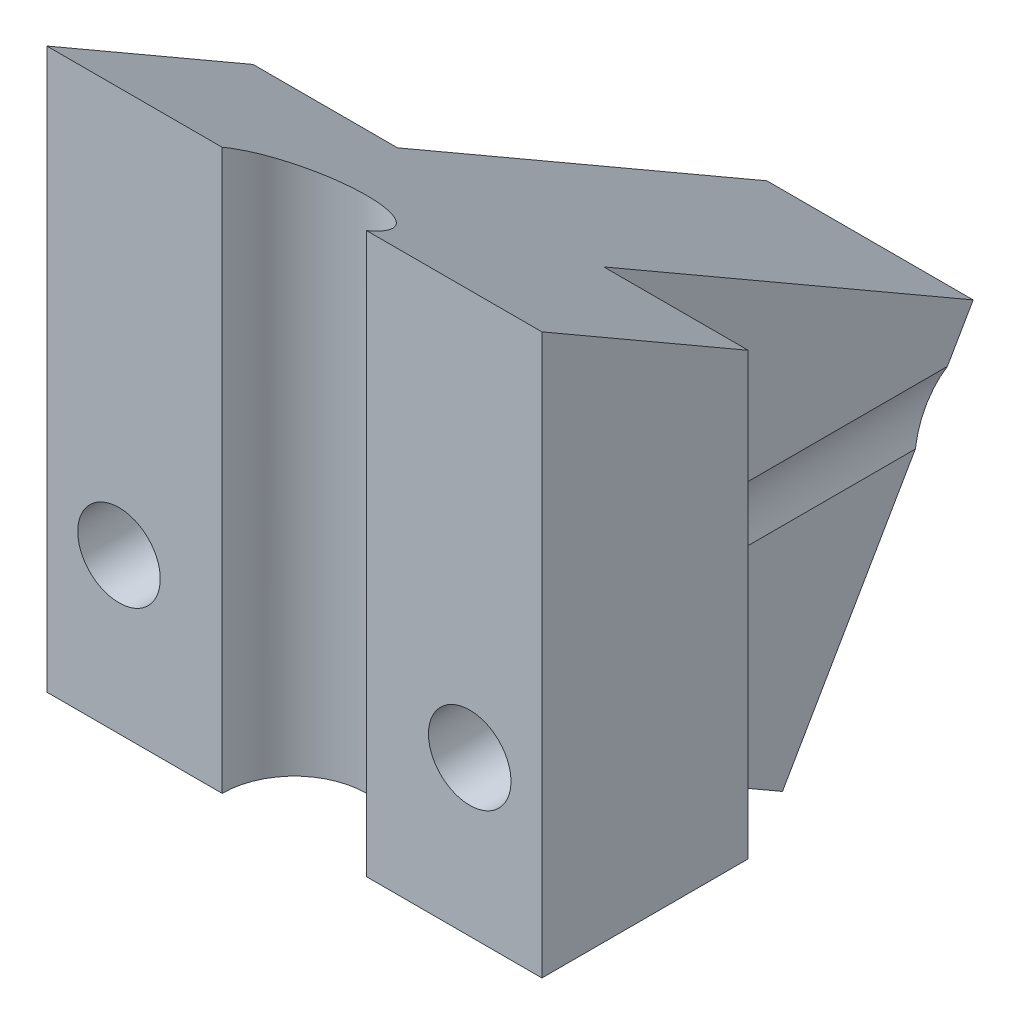
from build123d import *

# Parameters (mm, degrees)
SKETCH_1_W              = 48
SKETCH_1_H              = 20
EXTRUDE_1_DEPTH         = 30
SKETCH_2_W              = 14
SKETCH_2_H              = 30
CUT_EXTRUDE_1_DEPTH     = 7
EXTRUDE_2_DEPTH         = 48
CUT_EXTRUDE_2_DEPTH     = 14
CUT_EXTRUDE_3_DEPTH     = 14
CUT_EXTRUDE_4_DEPTH     = 65.456478054
SKETCH_13_R             = 4
CUT_EXTRUDE_5_DEPTH     = 53.52066051
SKETCH_14_R             = 4
CUT_EXTRUDE_6_DEPTH     = 53.52066051
FILLET_1_R              = 7
EXTRUDE_3_DEPTH         = 3
EXTRUDE_5_DEPTH         = 1
SKETCH_20_R             = 7.5
CUT_EXTRUDE_8_DEPTH     = 53.520660579
BOSS_EXTRUDE1_DEPTH     = 25
CUT_EXTRUDE1_DEPTH      = 80.244164279
CUT_EXTRUDE1_DEPTH_BACK = 80.244164279


with BuildPart() as part:
    # Эскиз1 → Бобышка-Вытянуть1 (new body)
    with BuildSketch(Plane(origin=(0, 0, 0), x_dir=(1, 0, 0), z_dir=(0, 1, 0))):
        Rectangle(SKETCH_1_W, SKETCH_1_H)
    extrude(amount=EXTRUDE_1_DEPTH)

    # Эскиз2 → Вырез-Вытянуть1 (cut)
    with BuildSketch(Plane.XY.offset(10)):
        with Locations((0, 15)):
            Rectangle(SKETCH_2_W, SKETCH_2_H)
    extrude(amount=-CUT_EXTRUDE_1_DEPTH, mode=Mode.SUBTRACT)

    # Эскиз7 → Бобышка-Вытянуть2 (add)
    with BuildSketch(Plane(origin=(24, 0, 0), x_dir=(0, 0, -1), z_dir=(1, 0, 0))):
        Polygon((10, 0), (27.320508076, -10), (45.810889132, 22.026279442), (32, 30), (10, 30), align=None)
    extrude(amount=-EXTRUDE_2_DEPTH)

    # Эскиз8 → Вырез-Вытянуть2 (cut)
    with BuildSketch(Plane(origin=(24, 0, 0), x_dir=(0, 0, -1), z_dir=(1, 0, 0))):
        Polygon((10, 0), (10, 30), (32, 30), (45.810889132, 22.026279442), (27.320508076, -10), align=None)
    extrude(amount=-CUT_EXTRUDE_2_DEPTH, mode=Mode.SUBTRACT)

    # Эскиз9 → Вырез-Вытянуть3 (cut)
    with BuildSketch(Plane.ZY.offset(24)):
        Polygon((-10, 0), (-10, 30), (-32, 30), (-45.810889132, 22.026279442), (-27.320508076, -10), align=None)
    extrude(amount=-CUT_EXTRUDE_3_DEPTH, mode=Mode.SUBTRACT)

    # Эскиз11 → Вырез-Вытянуть4 (cut, through all)
    with BuildSketch(Plane.ZY.offset(10)):
        Polygon((-17.221869062, 5.518829477), (-27.321869062, 23.012542633), (-36.15532818, 17.912542633), (-26.05532818, 0.418829477), align=None)
    extrude(amount=-CUT_EXTRUDE_4_DEPTH, mode=Mode.SUBTRACT)

    # Эскиз13 → Вырез-Вытянуть5 (cut, through all)
    with BuildSketch(Plane(origin=(0, 0, -10), x_dir=(-1, 0, 0), z_dir=(0, 0, -1))):
        with Locations((17, 15)):
            Circle(SKETCH_13_R)
    extrude(amount=-CUT_EXTRUDE_5_DEPTH, mode=Mode.SUBTRACT)

    # Эскиз14 → Вырез-Вытянуть6 (cut, through all)
    with BuildSketch(Plane(origin=(0, 0, -10), x_dir=(-1, 0, 0), z_dir=(0, 0, -1))):
        with Locations((-17, 15)):
            Circle(SKETCH_14_R)
    extrude(amount=-CUT_EXTRUDE_6_DEPTH, mode=Mode.SUBTRACT)

    # Скругление1
    fillet_1_edges = [part.edges().sort_by_distance(p)[0] for p in [
        (-7, 15, 3),
        (7, 15, 3),
    ]]
    fillet(fillet_1_edges, radius=FILLET_1_R - 0.0001)  # a hair under: the kernel refuses the full size

    # Эскиз16 → Бобышка-Вытянуть3 (add)
    with BuildSketch(Plane(origin=(10, 0, 0), x_dir=(0, 0, -1), z_dir=(1, 0, 0))):
        Polygon((27.321869062, 23.012542633), (17.221869062, 5.518829477), (26.05532818, 0.418829477), (36.15532818, 17.912542633), align=None)
    extrude(amount=-EXTRUDE_3_DEPTH)

    # Эскиз18 → Бобышка-Вытянуть5 (add)
    with BuildSketch(Plane(origin=(0, -14.330127019, -24.820508076), x_dir=(-1, 0, 0), z_dir=(0, -0.49999999999998845, -0.8660254037844453))):
        with BuildLine():
            Line((3.076923077, 23.490381057), (3.076923077, 15.490381057))
            Line((3.076923077, 15.490381057), (-0.394230769, 15.490381057))
            add(Edge.make_bspline(
                [(-0.394230769, 15.490381057), (-0.475966203, 15.49101845), (-0.634155568, 15.49225205), (-0.863556464, 15.501067061), (-1.077173272, 15.519794557), (-1.276352297, 15.540710881), (-1.460752713, 15.571594241), (-1.630462401, 15.607825992), (-1.784830485, 15.650647709), (-1.925031539, 15.701264755), (-2.055118116, 15.758511595), (-2.175664232, 15.829183977), (-2.291845901, 15.906492451), (-2.399031866, 15.998074814), (-2.502049745, 16.096470161), (-2.596586483, 16.206601733), (-2.685439891, 16.325713037), (-2.793473896, 16.498197991), (-2.906939016, 16.729401784), (-3.004668447, 17.02314385), (-3.06681146, 17.330727068), (-3.073519576, 17.5408315), (-3.076923077, 17.647432339)],
                knots=[0, 0, 0, 0, 1.242075696, 2.40389213, 3.487198984, 4.500157661, 5.446319301, 6.326791195, 7.136300648, 7.878370406, 8.590488565, 9.292260633, 9.999224673, 10.708050372, 11.431369221, 12.162165018, 12.910600795, 13.687589445, 15.252257874, 16.810406251, 18.381693487, 20, 20, 20, 20], degree=3))
            add(Edge.make_bspline(
                [(-3.076923077, 17.647432339), (-3.075357604, 17.715865612), (-3.072265688, 17.851026019), (-3.048581646, 18.049748215), (-3.005726368, 18.239618444), (-2.950775925, 18.42230348), (-2.87555432, 18.595200652), (-2.788453183, 18.761894703), (-2.680395045, 18.917607923), (-2.559742342, 19.067544403), (-2.419445088, 19.204937793), (-2.263386964, 19.331922341), (-2.086876234, 19.440896432), (-1.89570213, 19.542168691), (-1.684937787, 19.625339579), (-1.457761732, 19.698574242), (-1.21241575, 19.755040234), (-1.042362796, 19.783482773), (-0.955128205, 19.798073364)],
                knots=[0, 0, 0, 0, 0.982645791, 1.940792824, 2.867691729, 3.775150443, 4.675643875, 5.571354211, 6.471357401, 7.392684514, 8.331098131, 9.285922955, 10.275520706, 11.304845665, 12.388884831, 13.524255008, 14.729980297, 16, 16, 16, 16], degree=3))
            add(Edge.make_bspline(
                [(-0.955128205, 19.798073364), (-1.019738399, 19.830278555), (-1.14226585, 19.891352818), (-1.308999482, 19.992404668), (-1.455065559, 20.087536339), (-1.53803712, 20.158871679), (-1.576923077, 20.192304134)],
                knots=[0, 0, 0, 0, 1.172551213, 2.223638478, 3.167479604, 4, 4, 4, 4], degree=3))
            add(Edge.make_bspline(
                [(-1.576923077, 20.192304134), (-1.652624383, 20.266285408), (-1.807875296, 20.418008818), (-2.019735444, 20.678834883), (-2.229368535, 20.965668904), (-2.355227865, 21.174690137), (-2.419871795, 21.282047723)],
                knots=[0, 0, 0, 0, 0.918170575, 1.883016652, 2.912673989, 4, 4, 4, 4], degree=3))
            Line((-2.419871795, 21.282047723), (-3.732371795, 23.490381057))
            Line((-3.732371795, 23.490381057), (-2.439102564, 23.490381057))
            Line((-2.439102564, 23.490381057), (-1.442307692, 21.801278493))
            add(Edge.make_bspline(
                [(-1.442307692, 21.801278493), (-1.406465761, 21.74201577), (-1.337009983, 21.627174345), (-1.236719552, 21.459429826), (-1.138255761, 21.30508177), (-1.047376022, 21.15932531), (-0.958316878, 21.02600434), (-0.878481314, 20.900073272), (-0.798305584, 20.788666158), (-0.706246053, 20.654823189), (-0.593818414, 20.510114732), (-0.462623309, 20.361457059), (-0.34199814, 20.238315643), (-0.18956943, 20.120822362), (-3.2323e-05, 20.013245791), (0.159774488, 19.962214344), (0.237179487, 19.937496441)],
                knots=[0, 0, 0, 0, 1.130591283, 2.190900266, 3.190104209, 4.119071823, 4.994606968, 5.807262858, 6.55236009, 7.234593472, 8.459046683, 9.540234366, 10.471327768, 11.266723835, 12.676093724, 14, 14, 14, 14], degree=3))
            add(Edge.make_bspline(
                [(0.237179487, 19.937496441), (0.269697183, 19.931632396), (0.343936058, 19.918244603), (0.469993483, 19.909501015), (0.622727518, 19.900220866), (0.733416476, 19.900491258), (0.793269231, 19.900637467)],
                knots=[0, 0, 0, 0, 0.709978628, 1.620902492, 2.713552433, 4, 4, 4, 4], degree=3))
            Line((0.793269231, 19.900637467), (1.948717949, 19.900637467))
            Line((1.948717949, 19.900637467), (1.948717949, 23.490381057))
            Line((1.948717949, 23.490381057), (3.076923077, 23.490381057))
        make_face()
        with BuildLine():
            Line((1.948717949, 18.977560544), (-0.193910256, 18.977560544))
            add(Edge.make_bspline(
                [(-0.193910256, 18.977560544), (-0.301354607, 18.97589409), (-0.502211742, 18.972778811), (-0.783007271, 18.945769758), (-1.023200158, 18.903550736), (-1.225858519, 18.839427155), (-1.396173113, 18.753553027), (-1.54378517, 18.648537277), (-1.667901131, 18.51825252), (-1.769975791, 18.368861713), (-1.849770319, 18.206056724), (-1.90552669, 18.03374763), (-1.942959563, 17.855238544), (-1.946787014, 17.733092852), (-1.948717949, 17.6714708)],
                knots=[0, 0, 0, 0, 1.546056516, 2.890207646, 4.055830773, 5.050253158, 5.937355789, 6.790906573, 7.644595853, 8.512568064, 9.38593768, 10.244184789, 11.114197691, 12, 12, 12, 12], degree=3))
            add(Edge.make_bspline(
                [(-1.948717949, 17.6714708), (-1.947235583, 17.626563151), (-1.944332064, 17.538602257), (-1.928948857, 17.409542216), (-1.89968097, 17.287236957), (-1.859266003, 17.17080484), (-1.808094758, 17.059993077), (-1.745213393, 16.955237495), (-1.670946372, 16.857073145), (-1.585753391, 16.765016757), (-1.487970747, 16.681241729), (-1.376270424, 16.608965458), (-1.251544399, 16.547545272), (-1.113644587, 16.498798364), (-0.963006292, 16.459808698), (-0.798771701, 16.43387015), (-0.621691971, 16.415101097), (-0.498985984, 16.414015918), (-0.435897436, 16.41345798)],
                knots=[0, 0, 0, 0, 0.965235723, 1.89061323, 2.787065514, 3.661873922, 4.534873316, 5.404925039, 6.281839248, 7.175200054, 8.095223355, 9.040740021, 10.02630299, 11.075573487, 12.177989335, 13.364883635, 14.645170704, 16, 16, 16, 16], degree=3))
            Line((-0.435897436, 16.41345798), (1.948717949, 16.41345798))
            Line((1.948717949, 16.41345798), (1.948717949, 18.977560544))
        make_face(mode=Mode.SUBTRACT)
    extrude(amount=EXTRUDE_5_DEPTH)

    # Эскиз20 → Вырез-Вытянуть8 (cut, through all)
    with BuildSketch(Plane(origin=(0, 0, -10), x_dir=(-1, 0, 0), z_dir=(0, 0, -1))):
        with Locations((-17, 15)):
            Circle(SKETCH_20_R)
        with Locations((17, 15)):
            Circle(SKETCH_20_R)
    extrude(amount=CUT_EXTRUDE_8_DEPTH, mode=Mode.SUBTRACT)

    # Sketch3 → Boss-Extrude1 (add)
    with BuildSketch(Plane(origin=(0, 30, 0), x_dir=(1, 0, 0), z_dir=(0, 1, 0))):
        with BuildLine():
            Line((7, -10), (24, -10))
            Line((24, -10), (24, 10))
            Line((24, 10), (10, 10))
            Line((10, 10), (10, 32))
            Line((10, 32), (-10, 32))
            Line((-10, 32), (-10, 10))
            Line((-10, 10), (-24, 10))
            Line((-24, 10), (-24, -10))
            Line((-24, -10), (-7, -10))
            ThreePointArc((-7, -10), (0, -3), (7, -10))
        make_face()
    extrude(amount=BOSS_EXTRUDE1_DEPTH)

    # Sketch4 → Cut-Extrude1 (cut, two sides: drawn at the far end of the back side and taken through both)
    with BuildSketch(Plane.ZY.offset(10).offset(-CUT_EXTRUDE1_DEPTH_BACK)):
        Polygon((-251.050138586, -96.468656479), (-45.810889132, 22.026279442), (35.63071017, 69.046608722), (240.869959624, 187.541544642), (3.880087783, 598.020043549), (-488.040010426, 314.009842428), align=None)
    extrude(amount=CUT_EXTRUDE1_DEPTH + CUT_EXTRUDE1_DEPTH_BACK, mode=Mode.SUBTRACT)


solid = part.part
